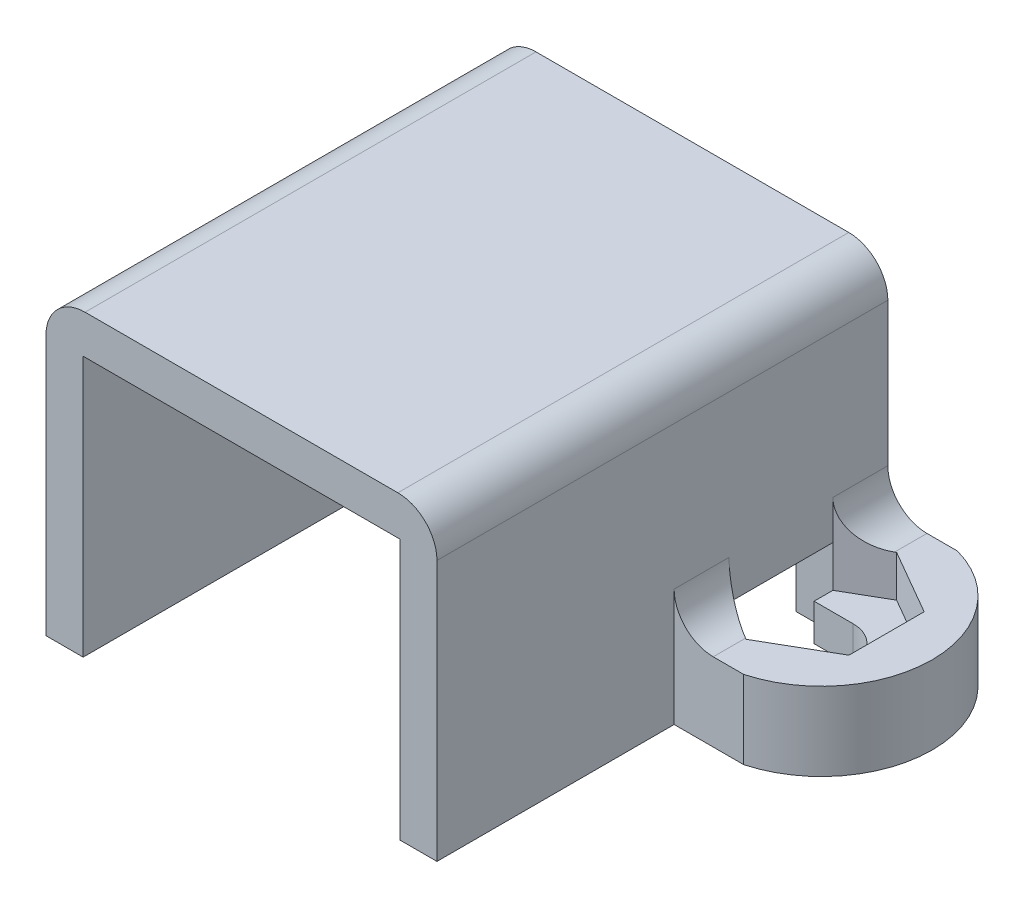
from build123d import *

# Parameters (mm, degrees)
SKETCH1_W          = 15
SKETCH1_H          = 17.3
EXTRUDE1_DEPTH     = 11.5
SKETCH2_W          = 12.15
SKETCH2_H          = 10
EXTRUDE2_DEPTH     = 17.3
EXTRUDE3_DEPTH     = 3
CUT_EXTRUDE3_DEPTH = 1.5875
CUT_EXTRUDE1_DEPTH = 18.998958303
FILLET3_R          = 1.5
FILLET1_R          = 1.5


with BuildPart() as part:
    # Sketch1 → Extrude1 (new body)
    with BuildSketch(Plane(origin=(0, 0, 0), x_dir=(1, 0, 0), z_dir=(0, 1, 0))):
        Rectangle(SKETCH1_W, SKETCH1_H)
    extrude(amount=EXTRUDE1_DEPTH)

    # Sketch2 → Extrude2 (cut)
    with BuildSketch(Plane.XY.offset(8.65)):
        with Locations((0, 5)):
            Rectangle(SKETCH2_W, SKETCH2_H)
    extrude(amount=-EXTRUDE2_DEPTH, mode=Mode.SUBTRACT)

    # Sketch3 → Extrude3 (add)
    with BuildSketch(Plane.XZ):
        with BuildLine():
            Line((7.5, -8.65), (10.169151464, -8.65))
            ThreePointArc((10.169151464, -8.65), (13.3, -4.55), (10.169151464, -0.45))
            Line((10.169151464, -0.45), (7.5, -0.45))
            Line((7.5, -0.45), (7.5, -8.65))
        make_face()
    extrude3 = extrude(amount=-EXTRUDE3_DEPTH)

    # Sketch8 → Cut-Extrude3 (cut)
    with BuildSketch(Plane(origin=(0, 3, 0), x_dir=(-1, 0, 0), z_dir=(0, 1, 0))):
        Polygon((-11.55, -5.993375673), (-9.05, -7.436751346), (-6.55, -5.993375673), (-6.55, -3.106624327), (-9.05, -1.663248654), (-11.55, -3.106624327), align=None)
    cut_extrude3 = extrude(amount=-CUT_EXTRUDE3_DEPTH, mode=Mode.SUBTRACT)

    # Sketch5 → Cut-Extrude1 (cut, through all)
    with BuildSketch(Plane.XZ.offset(-3)):
        with BuildLine():
            Line((9, -5.82), (7.5, -5.82))
            Line((7.5, -5.82), (7.5, -6.541858429))
            Line((7.5, -6.541858429), (6.075, -6.541858429))
            Line((6.075, -6.541858429), (6.075, -2.558141571))
            Line((6.075, -2.558141571), (7.5, -2.558141571))
            Line((7.5, -2.558141571), (7.5, -3.28))
            Line((7.5, -3.28), (9, -3.28))
            ThreePointArc((9, -3.28), (10.27, -4.55), (9, -5.82))
        make_face()
    cut_extrude1 = extrude(amount=CUT_EXTRUDE1_DEPTH, mode=Mode.SUBTRACT)

    # Mirror3: Extrude3, Cut-Extrude3, Cut-Extrude1 across plane
    add(extrude3.mirror(Plane(origin=(0, 0, 0), x_dir=(0, 0, 1), z_dir=(1, 0, 0))))
    add(cut_extrude3.mirror(Plane(origin=(0, 0, 0), x_dir=(0, 0, 1), z_dir=(1, 0, 0))), mode=Mode.SUBTRACT)
    add(cut_extrude1.mirror(Plane(origin=(0, 0, 0), x_dir=(0, 0, 1), z_dir=(1, 0, 0))), mode=Mode.SUBTRACT)

    # Fillet3
    fillet3_edges = [part.edges().sort_by_distance(p)[0] for p in [
        (-7.5, 11.5, 0),
        (7.5, 11.5, 0),
    ]]
    fillet(fillet3_edges, radius=FILLET3_R)

    # Fillet1
    # the kernel refuses this fillet: 1.5 mm, written as the material it adds along each edge
    with BuildSketch(Plane(origin=(7.5, 3, -0.45), x_dir=(0, 1, 0), z_dir=(0, 0, -1))) as fillet1_piece_1_section:
        with BuildLine():
            CenterArc((FILLET1_R, FILLET1_R), FILLET1_R, 180, 90)
            Line((0, FILLET1_R), (0, 0))
            Line((0, 0), (FILLET1_R, 0))
        make_face()
    fillet1_piece_1 = extrude(amount=5.858141571, mode=Mode.PRIVATE)
    fillet1_piece_1 = split(fillet1_piece_1, bisect_by=Plane(origin=(8.228724566, 3.349084614, -2.137412247), z_dir=(-0.5000000000000001, 0, 0.8660254037844386)), keep=Keep.TOP, mode=Mode.PRIVATE)
    add(fillet1_piece_1)
    with BuildSketch(Plane(origin=(7.5, 3, -2.791858429), x_dir=(0, 1, 0), z_dir=(0, 0, -1))) as fillet1_piece_2_section:
        with BuildLine():
            CenterArc((FILLET1_R, FILLET1_R), FILLET1_R, 180, 90)
            Line((0, FILLET1_R), (0, 0))
            Line((0, 0), (FILLET1_R, 0))
        make_face()
    fillet1_piece_2 = extrude(amount=5.858141571, mode=Mode.PRIVATE)
    fillet1_piece_2 = split(fillet1_piece_2, bisect_by=Plane(origin=(8.228724566, 3.349084614, -6.962587753), z_dir=(-0.5000000000000002, 0, -0.8660254037844386)), keep=Keep.TOP, mode=Mode.PRIVATE)
    add(fillet1_piece_2)
    with BuildSketch(Plane(origin=(-7.5, 3, -2.791858429), x_dir=(0, 1, 0), z_dir=(0, 0, -1))) as fillet1_piece_3_section:
        with BuildLine():
            CenterArc((FILLET1_R, -FILLET1_R), FILLET1_R, 90, 90)
            Line((0, -FILLET1_R), (0, 0))
            Line((0, 0), (FILLET1_R, 0))
        make_face()
    fillet1_piece_3 = extrude(amount=5.858141571, mode=Mode.PRIVATE)
    fillet1_piece_3 = split(fillet1_piece_3, bisect_by=Plane(origin=(-8.228724566, 3.349084614, -6.962587753), z_dir=(0.5000000000000002, 0, -0.8660254037844386)), keep=Keep.TOP, mode=Mode.PRIVATE)
    add(fillet1_piece_3)
    with BuildSketch(Plane(origin=(-7.5, 3, -0.45), x_dir=(0, 1, 0), z_dir=(0, 0, -1))) as fillet1_piece_4_section:
        with BuildLine():
            CenterArc((FILLET1_R, -FILLET1_R), FILLET1_R, 90, 90)
            Line((0, -FILLET1_R), (0, 0))
            Line((0, 0), (FILLET1_R, 0))
        make_face()
    fillet1_piece_4 = extrude(amount=5.858141571, mode=Mode.PRIVATE)
    fillet1_piece_4 = split(fillet1_piece_4, bisect_by=Plane(origin=(-8.228724566, 3.349084614, -2.137412247), z_dir=(0.5000000000000001, 0, 0.8660254037844386)), keep=Keep.TOP, mode=Mode.PRIVATE)
    add(fillet1_piece_4)


solid = part.part
